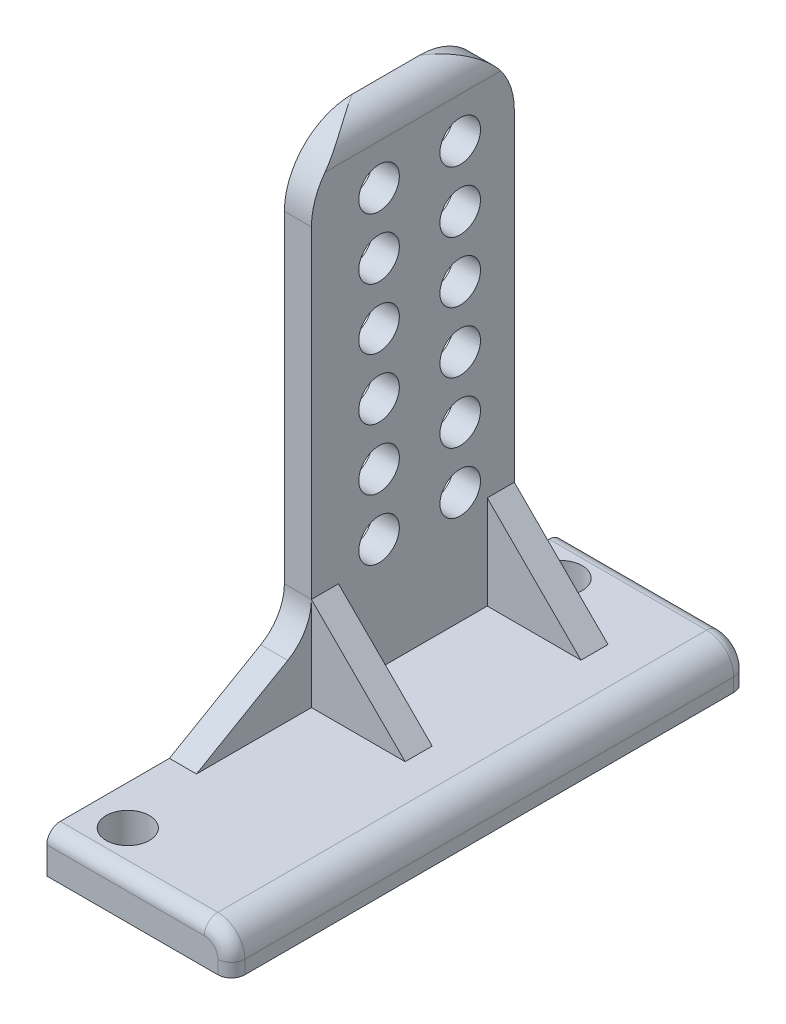
from build123d import *

# Parameters (mm, degrees)
SKETCH_1_R          = 1.5
EXTRUDE_1_DEPTH     = 2
FILLET_1_R          = 2
SKETCH_2_W          = 13.65
SKETCH_2_H          = 38.14
EXTRUDE_2_DEPTH     = 3
SKETCH_5_R          = 1.6
CUT_EXTRUDE_1_DEPTH = 51.34658541
FILLET_5_R          = 2
FILLET_6_R          = 1
RIB_5_REACH         = 45.465
SKETCH_6_WALL_W     = 98.727749582
SKETCH_6_WALL_H     = 2
RIB_8_REACH         = 52.268
SKETCH_8_WALL_W     = 112.334064404
SKETCH_8_WALL_H     = 2


with BuildPart() as part:
    # 草图1 → 凸台-拉伸1 (new body)
    with BuildSketch(Plane(origin=(0, 0, 0), x_dir=(0, 0, -1), z_dir=(1, 0, 0))):
        with BuildLine():
            Line((8.5, 6.92820323), (8.5, 30.773589654))
            ThreePointArc((8.5, 30.773589654), (9.964466094, 34.30912356), (13.5, 35.773589654))
            Line((13.5, 35.773589654), (18.5, 35.773589654))
            ThreePointArc((18.5, 35.773589654), (22.035533906, 34.30912356), (23.5, 30.773589654))
            Line((23.5, 30.773589654), (23.5, 0))
            Line((23.5, 0), (0, 0))
            Line((0, 0), (6.75, 3.897114317))
            ThreePointArc((6.75, 3.897114317), (8.031088913, 5.17820323), (8.5, 6.92820323))
        make_face()
        with Locations((19.5, 30.773589654)):
            Circle(SKETCH_1_R, mode=Mode.SUBTRACT)
        with Locations((13.5, 30.773589654)):
            Circle(SKETCH_1_R, mode=Mode.SUBTRACT)
        with Locations((19.5, 26.273589654)):
            Circle(SKETCH_1_R, mode=Mode.SUBTRACT)
        with Locations((13.5, 26.273589654)):
            Circle(SKETCH_1_R, mode=Mode.SUBTRACT)
        with Locations((19.5, 21.773589654)):
            Circle(SKETCH_1_R, mode=Mode.SUBTRACT)
        with Locations((13.5, 21.773589654)):
            Circle(SKETCH_1_R, mode=Mode.SUBTRACT)
        with Locations((19.5, 17.273589654)):
            Circle(SKETCH_1_R, mode=Mode.SUBTRACT)
        with Locations((13.5, 17.273589654)):
            Circle(SKETCH_1_R, mode=Mode.SUBTRACT)
        with Locations((19.5, 12.773589654)):
            Circle(SKETCH_1_R, mode=Mode.SUBTRACT)
        with Locations((13.5, 12.773589654)):
            Circle(SKETCH_1_R, mode=Mode.SUBTRACT)
        with Locations((19.5, 8.273589654)):
            Circle(SKETCH_1_R, mode=Mode.SUBTRACT)
        with Locations((13.5, 8.273589654)):
            Circle(SKETCH_1_R, mode=Mode.SUBTRACT)
    extrude(amount=EXTRUDE_1_DEPTH)

    # 圆角1
    # the kernel refuses this fillet: 2 mm, written as the material it takes off along each edge
    with BuildSketch(Plane(origin=(2, 35.773589654, -8.5), x_dir=(-1, 0, 0), z_dir=(0, 0, -1))) as fillet_1_piece_1:
        with BuildLine():
            CenterArc((FILLET_1_R, -FILLET_1_R), FILLET_1_R, 90, 90)
            Line((0, -FILLET_1_R), (0, 0))
            Line((0, 0), (FILLET_1_R, 0))
        make_face()
    extrude(amount=15, mode=Mode.SUBTRACT)

    # 草图2 → 凸台-拉伸2 (add)
    with BuildSketch(Plane.XZ):
        with Locations((6.825, -10)):
            Rectangle(SKETCH_2_W, SKETCH_2_H)
    extrude(amount=EXTRUDE_2_DEPTH)

    # 草图5 → 切除-拉伸1 (cut, through all)
    with BuildSketch(Plane.XZ.offset(3)):
        with Locations(Location((2.92, 6, 0), (0, 0, 270))):
            Circle(SKETCH_5_R)
        with Locations(Location((2.92, -26, 0), (0, 0, 270))):
            Circle(SKETCH_5_R)
    extrude(amount=-CUT_EXTRUDE_1_DEPTH, mode=Mode.SUBTRACT)

    # 圆角5
    fillet_5_edges = [part.edges().sort_by_distance(p)[0] for p in [
        (13.65, 0, -10),
    ]]
    fillet(fillet_5_edges, radius=FILLET_5_R)

    # 圆角6
    fillet_6_edges = [part.edges().sort_by_distance(p)[0] for p in [
        (5.825, 0, 9.07),
        (13.064213562, -0.585786438, 9.07),
        (13.064213562, -0.585786438, -29.07),
        (5.825, 0, -29.07),
        (13.65, -2.5, -29.07),
        (13.65, -2.5, 9.07),
    ]]
    fillet(fillet_6_edges, radius=FILLET_6_R)

    # 草图6 wall → 筋5 (add, up to next)
    with BuildSketch(Plane(origin=(5.464101615, 3.464101615, -8.5), x_dir=(0.707106781187, -0.707106781187, 0), z_dir=(0.707106781187, 0.707106781187, 0)), mode=Mode.PRIVATE) as rib_5_sk1:
        with Locations((0, 1)):
            Rectangle(SKETCH_6_WALL_W, SKETCH_6_WALL_H)
    rib_5_tool1 = extrude(rib_5_sk1.sketch, amount=-RIB_5_REACH, mode=Mode.PRIVATE) - part.part
    add(rib_5_tool1.solids().sort_by_distance((5.464101615, 3.464101615, -8.5))[0])

    # 草图8 wall → 筋8 (add, up to next)
    with BuildSketch(Plane(origin=(5.464101615, 3.464101615, -23.5), x_dir=(0.707106781187, -0.707106781187, 0), z_dir=(-0.707106781187, -0.707106781187, 0)), mode=Mode.PRIVATE) as rib_8_sk1:
        with Locations((0, 1)):
            Rectangle(SKETCH_8_WALL_W, SKETCH_8_WALL_H)
    rib_8_tool1 = extrude(rib_8_sk1.sketch, amount=RIB_8_REACH, mode=Mode.PRIVATE) - part.part
    add(rib_8_tool1.solids().sort_by_distance((5.464101615, 3.464101615, -23.5))[0])


solid = part.part
